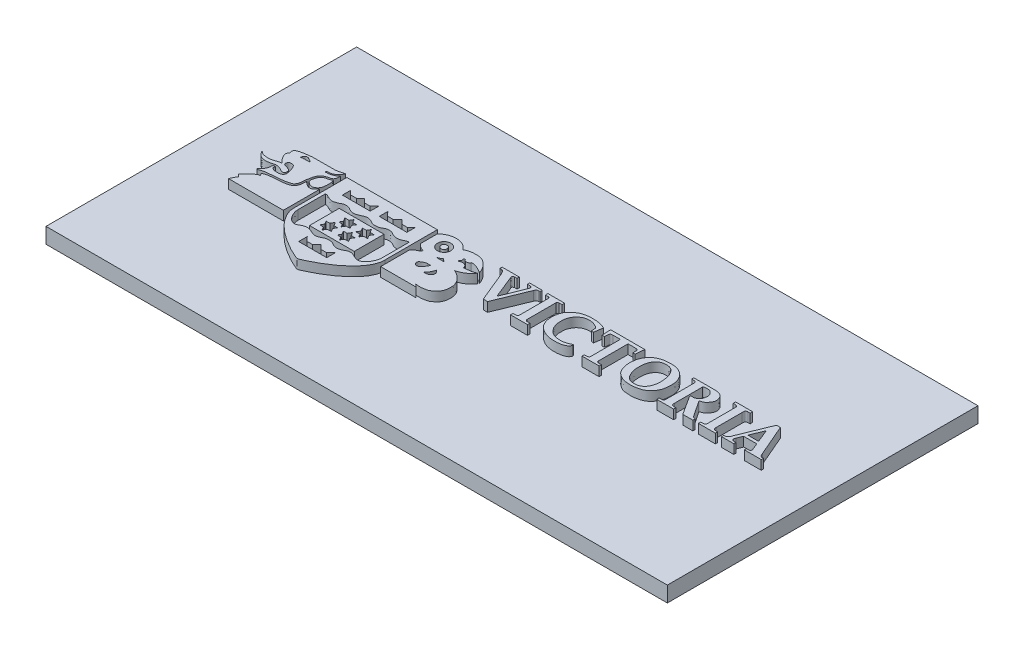
from build123d import *

# Parameters (mm, degrees)
SKETCH1_W           = 200
SKETCH1_H           = 100
BOSS_EXTRUDE1_DEPTH = 5
SKETCH5_R           = 2.143894701
BOSS_EXTRUDE3_DEPTH = 3
SKETCH5_3_W         = 14.41132594
SKETCH5_3_H         = 9.558249628
SKETCH5_3_R         = 0.989458564
BOSS_EXTRUDE4_DEPTH = 3


with BuildPart() as part:
    # Sketch1 → Boss-Extrude1 (new body)
    with BuildSketch(Plane(origin=(0, 0, 0), x_dir=(1, 0, 0), z_dir=(0, 1, 0))):
        Rectangle(SKETCH1_W, SKETCH1_H)
    extrude(amount=BOSS_EXTRUDE1_DEPTH)

    # Sketch5 → Boss-Extrude3 (add)
    # profile 1 of 13: a face of its own
    with BuildSketch(Plane(origin=(0, 5, 0), x_dir=(1, 0, 0), z_dir=(0, 1, 0))):
        with BuildLine():
            Line((-63.283166059, -10.311134078), (-63.283166059, 1.373853789))
            add(Edge.make_bspline(
                [(-80.903714055, -10.311134078), (-80.856683264, -9.888312313), (-80.400800592, -9.362663986), (-80.157531155, -8.594305814), (-79.911209896, -8.308751368), (-79.781007463, -8.153542612), (-79.991127499, -7.996810384), (-80.162171046, -7.827277063), (-80.381110118, -7.681743058), (-80.615269402, -7.456702061), (-80.389779728, -7.310528979), (-80.300552877, -7.103815631), (-80.060636971, -6.947854996), (-79.939504866, -6.658845543), (-79.683496145, -6.433065), (-79.416142552, -6.225120293), (-79.178429481, -5.909778113), (-78.832255732, -5.621183705), (-78.47889549, -5.353746245), (-78.186251702, -5.05760081), (-77.902886181, -4.847865328), (-77.612103844, -4.650200381), (-77.309035222, -4.456523123), (-76.958395472, -4.357557253), (-76.736483954, -4.390747801), (-76.499412598, -4.313856384), (-76.674403661, -4.222818699), (-76.782548313, -4.111338792), (-76.951429305, -3.961113457), (-76.981132542, -3.781476055), (-77.108662934, -3.691593107), (-76.984219704, -3.553477829), (-76.821266945, -3.491015762), (-76.642042219, -3.30190718), (-76.356111996, -3.244439062), (-76.045646115, -3.140442093), (-75.64088629, -3.038052469), (-75.139928715, -2.951242258), (-74.559702195, -2.941266374), (-74.050596444, -2.82899301), (-73.587687513, -2.869364074), (-73.13080307, -2.752608204), (-72.529458147, -2.709939541), (-71.865979355, -2.680506971), (-71.228161254, -2.657259405), (-70.650578937, -2.528955422), (-70.066398669, -2.476029844), (-69.415694963, -2.262756639), (-68.761320966, -2.034587365), (-68.164848126, -1.539122688), (-67.877312077, -0.900727809), (-67.678504157, -0.26285911), (-67.604908909, 0.426021816), (-67.59898699, 1.026916374), (-67.573360912, 1.366004939), (-67.584588655, 1.535686091), (-67.444849643, 1.431897383), (-67.423380431, 1.299934716), (-67.274655994, 1.123199209), (-67.067888604, 1.025955291), (-66.901332432, 0.81573915), (-66.666069177, 0.665306076), (-66.381973993, 0.484522977), (-66.095757591, 0.313506358), (-65.771166739, 0.214663654), (-65.450377689, 0.129322739), (-65.077171478, 0.091354901), (-64.704079619, 0.205663372), (-64.36312652, 0.453633415), (-64.02783364, 0.744247371), (-63.690638785, 1.000023947), (-63.474818288, 1.244284099), (-63.384721339, 1.424324463), (-63.283166059, 1.373853789)],
                knots=[0, 0, 0, 0, 0.044727949, 0.076095667, 0.084620858, 0.088722162, 0.095224687, 0.107117358, 0.117598152, 0.12632139, 0.13419106, 0.140594358, 0.151685856, 0.163923512, 0.174209887, 0.188942408, 0.201320064, 0.217531518, 0.238556002, 0.250302024, 0.263444351, 0.277471635, 0.289076417, 0.303608236, 0.314612495, 0.318388932, 0.32285075, 0.328773874, 0.338724192, 0.345324539, 0.348717892, 0.352734553, 0.361178541, 0.369737086, 0.37990455, 0.392591261, 0.406163188, 0.42596187, 0.448676137, 0.470163609, 0.483089202, 0.499515099, 0.521778291, 0.549654919, 0.573043646, 0.59210845, 0.614943667, 0.637595681, 0.667614925, 0.691050126, 0.720933441, 0.743473942, 0.76460259, 0.798327908, 0.80506505, 0.808129672, 0.811612582, 0.817581269, 0.824422472, 0.835458236, 0.842573333, 0.853558934, 0.866045916, 0.879965481, 0.890146869, 0.903404045, 0.916740876, 0.931013295, 0.945346224, 0.963028113, 0.980302157, 0.991498863, 1, 1, 1, 1], degree=3))
            Line((-80.903714055, -10.311134078), (-63.283166059, -10.311134078))
        make_face()
    # profile 2 of 13: a face of its own
    with BuildSketch(Plane(origin=(0, 5, 0), x_dir=(1, 0, 0), z_dir=(0, 1, 0))):
        with BuildLine():
            Line((-33.087033974, 9.049574075), (-62.209328463, 9.049574075))
            Line((-62.209328463, 9.049574075), (-62.209328463, -7.826517048))
            add(Edge.make_bspline(
                [(-62.209328463, -7.826517048), (-62.223611334, -8.420607225), (-62.147702892, -9.357654807), (-61.704570785, -10.405774753), (-61.415861108, -11.072053428), (-61.085423492, -11.590336841), (-60.819873467, -12.16205615), (-60.369451276, -12.646598187), (-60.059213276, -13.162226499), (-59.653780288, -13.576285059), (-59.357478437, -14.052514208), (-58.890344102, -14.400144848), (-58.552317735, -14.808070578), (-58.135168968, -15.138232389), (-57.737363922, -15.53219111), (-57.312920719, -15.957750788), (-56.741185316, -16.386329531), (-56.111017414, -16.837334967), (-55.415465073, -17.36589135), (-54.703069589, -17.893601429), (-53.874265971, -18.356009853), (-52.994400953, -18.947160994), (-52.013764501, -19.505219417), (-50.918542775, -20.132624571), (-49.715351254, -20.714530074), (-48.617982696, -21.156726636), (-47.917471144, -21.502785007), (-47.251925435, -21.501424295), (-46.616684887, -21.180278547), (-45.74364458, -20.756541906), (-44.886481163, -20.394436649), (-43.839085801, -19.785099657), (-42.728976128, -19.282062332), (-41.822137384, -18.618968022), (-41.062197101, -18.185738276), (-40.255588753, -17.590428361), (-39.158503272, -17.00054878), (-38.362952334, -16.144262319), (-37.565005123, -15.589463365), (-36.988954762, -15.096958849), (-36.488718026, -14.448546693), (-35.819582772, -13.948413874), (-35.331227737, -13.251876172), (-34.84129076, -12.640616607), (-34.381252363, -12.028200551), (-34.039916143, -11.393193763), (-33.728975923, -10.760473844), (-33.478324525, -10.211752183), (-33.168539038, -9.2539561), (-33.040809768, -8.464527884), (-33.087033974, -7.826517048)],
                knots=[0, 0, 0, 0, 0.042744702, 0.065587763, 0.081029106, 0.094527413, 0.109445821, 0.125721284, 0.141362611, 0.15220027, 0.166973682, 0.180921032, 0.193282425, 0.20465161, 0.218792191, 0.233277462, 0.24751857, 0.269744212, 0.288662347, 0.309936615, 0.332989395, 0.356357403, 0.385629891, 0.41353483, 0.446608274, 0.480612804, 0.499340582, 0.500190577, 0.528083172, 0.547671863, 0.570277339, 0.594253874, 0.634235093, 0.656911408, 0.674293258, 0.696649025, 0.72848131, 0.762545413, 0.779125162, 0.79787212, 0.816417692, 0.837311173, 0.856850995, 0.876739058, 0.893394512, 0.911440478, 0.928113728, 0.943801852, 0.954450612, 1, 1, 1, 1], degree=3))
            Line((-33.087033974, -7.826517048), (-33.087033974, 9.049574075))
        make_face()
        Polygon((-43.087643254, -16.551320804), (-52.110677227, -16.551320804), (-52.110677227, -13.789555653), (-50.866334758, -15.170438228), (-49.063325432, -15.170438228), (-47.666785498, -13.773898295), (-46.270245565, -15.170438228), (-44.484183187, -15.170438228), (-43.087643254, -13.773898295), align=None, mode=Mode.SUBTRACT)
        with BuildLine():
            add(Edge.make_bspline(
                [(-61.106333757, 1.044862887), (-60.550114803, 1.078370375), (-59.831943985, 0.657276143), (-58.802921124, 0.172672351), (-57.771769356, 0.030089416), (-56.899428442, 0.381957032), (-56.124151668, 0.65286917), (-55.494838076, 1.087230789), (-54.707979785, 1.191934216), (-53.933268916, 1.126289317), (-53.313391386, 0.931985165), (-52.859774368, 0.615685085), (-52.374208122, 0.415450837), (-51.92938191, 0.144943812), (-51.305151939, 0.098947453), (-50.616882182, 0.163801812), (-49.885541378, 0.405950628), (-49.229337694, 0.726485749), (-48.620433802, 1.015772418), (-47.990340764, 1.190798724), (-47.250997519, 1.199258043), (-46.526873253, 0.928397166), (-45.832792242, 0.684471494), (-45.262010528, 0.217132962), (-44.575100549, 0.162326561), (-43.841644644, 0.159026384), (-43.079340992, 0.277747754), (-42.356133913, 0.63587579), (-41.745636499, 1.080086914), (-41.039654092, 1.179660633), (-40.30346453, 1.199620391), (-39.431854458, 0.943291452), (-38.654684943, 0.416272838), (-37.88297859, 0.236151865), (-37.066947745, 0.135603224), (-36.21984093, 0.29101926), (-35.213099399, 0.757296929), (-34.574589443, 1.101740059), (-34.133410576, 1.061452069)],
                knots=[0, 0, 0, 0, 0.055543947, 0.08629356, 0.12004875, 0.161437862, 0.18333029, 0.206677282, 0.240875107, 0.264007063, 0.288750082, 0.308187582, 0.32186975, 0.344145665, 0.361977019, 0.38658574, 0.416898736, 0.442463684, 0.46365945, 0.487890017, 0.510902227, 0.54021374, 0.568663547, 0.588121718, 0.616068455, 0.638164593, 0.66621975, 0.6961474, 0.722721347, 0.744306345, 0.769848027, 0.800195999, 0.838188386, 0.867733621, 0.882609215, 0.924852637, 0.955794948, 1, 1, 1, 1], degree=3))
            Line((-34.133410576, 1.061452069), (-34.133410576, -7.826517048))
            add(Edge.make_bspline(
                [(-61.106333757, -7.826517048), (-61.128880642, -8.567381891), (-60.766667061, -9.428643338), (-60.285029507, -10.522107363), (-59.789020035, -11.1229071), (-59.235378104, -11.815471707), (-58.476151657, -12.145668376), (-57.668323915, -12.355394699), (-56.87340605, -12.057563858), (-56.152150093, -11.575839587), (-55.349039959, -11.300422077), (-54.465023067, -11.184385291), (-53.648999738, -11.366422187), (-52.949624995, -11.670880126), (-52.359595864, -11.98233987), (-51.733942174, -12.23959105), (-50.679556193, -12.321974753), (-49.667289322, -11.887763123), (-48.618900625, -11.297379309), (-47.826834473, -11.239030924), (-47.023885329, -11.26516572), (-46.35302653, -11.459358634), (-45.740977779, -11.835515971), (-45.120032138, -12.115641438), (-44.396941682, -12.338778017), (-43.553170936, -12.265437597), (-42.822814465, -11.968797427), (-42.107632059, -11.556760141), (-41.415663469, -11.247648979), (-40.620717035, -11.157415441), (-39.886529363, -11.370358923), (-39.063464156, -11.676976763), (-38.264609212, -12.203760273), (-37.326820282, -12.272140838), (-36.277862108, -12.023180549), (-35.44563443, -11.197922317), (-34.566997687, -9.789425813), (-34.146241616, -8.644514382), (-34.133410576, -7.826517048)],
                knots=[0, 0, 0, 0, 0.062933835, 0.084534597, 0.106498042, 0.132747492, 0.162843066, 0.178970509, 0.206403155, 0.234812252, 0.257469012, 0.281815998, 0.314049535, 0.330893164, 0.350297743, 0.374037615, 0.390983023, 0.443874361, 0.469082849, 0.498456421, 0.513280978, 0.5413852, 0.559680164, 0.577664638, 0.60255265, 0.626637054, 0.651997063, 0.672744898, 0.700874852, 0.719370493, 0.743227648, 0.768474036, 0.798423678, 0.82743031, 0.849988951, 0.893562834, 0.927221799, 1, 1, 1, 1], degree=3))
            Line((-61.106333757, -7.826517048), (-61.106333757, 1.044862887))
        make_face(mode=Mode.SUBTRACT)
        Polygon((-49.063325432, 3.415154074), (-58.007374204, 3.415154074), (-58.007374204, 6.070630459), (-56.725249742, 4.788505997), (-54.877319073, 4.788505997), (-53.535349818, 6.130475252), (-52.193380563, 4.788505997), (-50.436677355, 4.788505997), (-49.063325432, 6.16185792), align=None, mode=Mode.SUBTRACT)
        Polygon((-46.139661916, 3.415154074), (-46.139661916, 6.16185792), (-44.872424653, 4.803283502), (-43.110285584, 4.803283502), (-41.700058458, 6.213510629), (-40.351682779, 4.865134951), (-38.557177968, 4.865134951), (-37.260454999, 6.16185792), (-37.260454999, 3.415154074), align=None, mode=Mode.SUBTRACT)
    # profile 3 of 13: a face of its own
    with BuildSketch(Plane(origin=(0, 5, 0), x_dir=(1, 0, 0), z_dir=(0, 1, 0))):
        with BuildLine():
            add(Edge.make_bspline(
                [(-23.342264199, 7.545540249), (-23.672904406, 8.029140409), (-24.426583649, 8.765212124), (-25.82525957, 9.512750578), (-27.368277457, 9.704820245), (-29.036985546, 9.608992993), (-30.65693015, 8.955695587), (-31.540076328, 8.201227044), (-31.921838602, 7.783283119)],
                knots=[0, 0, 0, 0, 0.178613289, 0.318982495, 0.477007698, 0.647910067, 0.826705352, 1, 1, 1, 1], degree=3))
            Line((-31.921838602, 7.783283119), (-31.921838602, 2.565075319))
            add(Edge.make_bspline(
                [(-31.921838602, -0.959278605), (-31.682686752, -0.730105535), (-31.246034301, -0.373253192), (-30.578984422, 0.012476599), (-30.026131501, 0.220230754), (-29.753169678, 0.549589112), (-29.524402395, 0.860497489), (-29.816012777, 1.102588389), (-30.1715122, 1.125337255), (-30.685526301, 1.330888796), (-31.287440333, 1.825447706), (-31.798268081, 2.195675357), (-31.921838602, 2.565075319)],
                knots=[0, 0, 0, 0, 0.167260575, 0.280115119, 0.391310729, 0.448966334, 0.506302735, 0.545037078, 0.608247957, 0.687788788, 0.816650379, 1, 1, 1, 1], degree=3))
            Line((-31.921838602, -0.959278605), (-31.921838602, -10.3593181))
            Line((-31.921838602, -10.3593181), (-20.548463142, -10.3593181))
            add(Edge.make_bspline(
                [(-20.548463142, -10.3593181), (-20.690169311, -10.152966306), (-21.028207107, -9.791285476), (-21.32508953, -9.691211598), (-21.498625745, -9.549608527), (-21.38531335, -9.567401191), (-21.185580228, -9.544678873), (-20.804506243, -9.684878225), (-20.281157243, -9.679386716), (-19.76177878, -9.685274922), (-19.239376685, -9.632436029), (-18.708740178, -9.556071309), (-18.117156264, -9.435559564), (-17.378064742, -9.229982315), (-16.623009533, -8.664319785), (-15.844112266, -8.117715099), (-15.391308796, -7.364796024), (-15.081158616, -6.670468088), (-14.877242965, -5.862536972), (-14.871815746, -4.941418225), (-14.815209729, -4.063004422), (-15.054822907, -3.339427983), (-15.346378286, -2.590110697), (-15.885083272, -1.794659156), (-16.63196195, -0.942367535), (-17.416332076, -0.356107975), (-18.19591782, 0.115614408), (-18.700963651, 0.335224459), (-19.015362167, 0.40295312)],
                knots=[0, 0, 0, 0, 0.047311833, 0.065555571, 0.068886764, 0.072240714, 0.077912826, 0.108647754, 0.132673809, 0.167071751, 0.195287611, 0.220799851, 0.256954468, 0.296851956, 0.347894575, 0.41397467, 0.454077007, 0.493307928, 0.541711161, 0.592299153, 0.64796658, 0.687349555, 0.718815557, 0.782883517, 0.84704878, 0.908354783, 0.946211382, 1, 1, 1, 1], degree=3))
            add(Edge.make_bspline(
                [(-19.015362167, 0.40295312), (-17.195285517, 0.787051534), (-15.527555678, 1.890610408), (-14.478556775, 3.445259634)],
                knots=[0, 0, 0, 0, 1, 1, 1, 1], degree=3))
            add(Edge.make_bspline(
                [(-14.478556775, 3.445259634), (-14.998116976, 3.167579259), (-15.840094343, 2.886579147), (-17.167636476, 2.768563028), (-17.901206361, 2.617440427), (-18.36194365, 2.635435319)],
                knots=[0, 0, 0, 0, 0.442148354, 0.655070643, 1, 1, 1, 1], degree=3))
            add(Edge.make_bspline(
                [(-18.36194365, 2.635435319), (-18.27735476, 3.049035953), (-18.685947619, 3.656769386), (-19.564926451, 3.988460507), (-20.329842635, 4.018620937), (-20.689752116, 3.588803508), (-21.065116934, 3.714319633), (-20.902149866, 4.097696023), (-20.582349324, 4.340011927), (-20.624495469, 4.771226144), (-20.77372742, 5.125939518), (-20.483635574, 5.311257952), (-20.177652029, 5.247675859), (-20.114233643, 4.910809796), (-19.643416437, 4.744082371), (-19.112764798, 4.759790841), (-18.633260539, 4.93054883), (-18.300383688, 5.154986886), (-18.405718937, 5.434985072), (-18.183299862, 5.414661204), (-17.859545641, 5.358060433), (-17.197738832, 5.255254157), (-15.94451159, 4.827515185), (-14.95570904, 4.295463236), (-14.323743695, 3.803340989)],
                knots=[0, 0, 0, 0, 0.09570499, 0.157406657, 0.231164579, 0.262504401, 0.28131965, 0.304328191, 0.341480827, 0.37941162, 0.40092338, 0.425807103, 0.445368092, 0.468277521, 0.498049346, 0.556338794, 0.596569859, 0.627463779, 0.639447878, 0.645271086, 0.672698219, 0.729115932, 0.803292351, 1, 1, 1, 1], degree=3))
            add(Edge.make_bspline(
                [(-14.323743695, 3.803340989), (-14.484322888, 4.395296449), (-14.875207142, 5.269842309), (-15.62101847, 6.312829703), (-16.362593288, 7.082558736), (-17.266603081, 7.793563213), (-18.494470191, 8.352270399), (-19.89259095, 8.402423755), (-21.22786245, 8.355338875), (-22.371468289, 8.025363529), (-23.07131154, 7.806995771), (-23.342264199, 7.545540249)],
                knots=[0, 0, 0, 0, 0.161629313, 0.250595519, 0.337392553, 0.443077719, 0.553128084, 0.68665681, 0.807763151, 0.904497994, 1, 1, 1, 1], degree=3))
        make_face()
        with BuildLine():
            add(Edge.make_bspline(
                [(-21.986118744, -2.324138385), (-21.658179071, -2.621714338), (-20.921458184, -3.305850896), (-21.568193433, -4.870598703), (-22.775407012, -5.096241044), (-23.487146283, -4.969848311)],
                knots=[0, 0, 0, 0, 0.334220384, 0.506123893, 1, 1, 1, 1], degree=3))
            add(Edge.make_bspline(
                [(-23.487146283, -4.969848311), (-22.722905076, -4.287484969), (-22.115212205, -3.356951376), (-21.986118744, -2.324138385)],
                knots=[0, 0, 0, 0, 1, 1, 1, 1], degree=3))
        make_face(mode=Mode.SUBTRACT)
        with BuildLine():
            add(Edge.make_bspline(
                [(-24.156372472, -1.965162674), (-24.42716302, -2.466481474), (-24.827628878, -3.205782787), (-25.482273047, -4.071006882), (-26.252914365, -4.420263195), (-27.051100175, -4.164127292), (-27.888455779, -2.747961869), (-25.645942274, -1.960860378), (-25.277864395, -1.965162674)],
                knots=[0, 0, 0, 0, 0.228004413, 0.340633351, 0.42813331, 0.550140895, 0.644082761, 1, 1, 1, 1], degree=3))
            Line((-25.277864395, -1.965162674), (-24.156372472, -1.965162674))
        make_face(mode=Mode.SUBTRACT)
        with BuildLine():
            Line((-22.970538661, 1.163504897), (-25.50832241, 1.163504897))
            add(Edge.make_bspline(
                [(-25.50832241, 1.163504897), (-25.047567966, 1.413475651), (-24.310882776, 1.545813707), (-24.056353129, 2.086767421)],
                knots=[0, 0, 0, 0, 1, 1, 1, 1], degree=3))
            add(Edge.make_bspline(
                [(-22.970538661, 1.163504897), (-23.338369515, 1.447301122), (-23.854954628, 1.627002668), (-24.056353129, 2.086767421)],
                knots=[0, 0, 0, 0, 1, 1, 1, 1], degree=3))
        make_face(mode=Mode.SUBTRACT)
        with Locations((-27.170207698, 5.324777386)):
            Circle(SKETCH5_R, mode=Mode.SUBTRACT)
    # profile 4 of 13: a face of its own
    with BuildSketch(Plane(origin=(0, 5, 0), x_dir=(1, 0, 0), z_dir=(0, 1, 0))):
        with BuildLine():
            Line((-6.690237885, 9.049574075), (-12.22534272, 9.049574075))
            Line((-12.22534272, 9.049574075), (-12.22534272, 8.337457413))
            Line((-12.22534272, 8.337457413), (-11.690833019, 8.337457413))
            add(Edge.make_bspline(
                [(-10.450715145, 7.015844375), (-10.749533067, 7.471265436), (-11.017038592, 8.296579831), (-11.690833019, 8.337457413)],
                knots=[0, 0, 0, 0, 1, 1, 1, 1], degree=3))
            Line((-10.450715145, 7.015844375), (-6.327751146, -2.896014384))
            Line((-6.327751146, -2.896014384), (-4.961901365, -2.896014384))
            Line((-4.961901365, -2.896014384), (-0.678836073, 7.545540249))
            add(Edge.make_bspline(
                [(-0.678836073, 7.545540249), (-0.557814387, 7.929914412), (-0.252977784, 8.313084233), (0.185479461, 8.337457413)],
                knots=[0, 0, 0, 0, 1, 1, 1, 1], degree=3))
            Line((0.185479461, 8.337457413), (0.683160918, 8.337457413))
            Line((0.683160918, 8.337457413), (0.683160918, 9.049574075))
            Line((0.683160918, 9.049574075), (-3.377173182, 9.049574075))
            Line((-3.377173182, 9.049574075), (-3.377173182, 8.337457413))
            Line((-3.377173182, 8.337457413), (-2.359161235, 8.337457413))
            add(Edge.make_bspline(
                [(-2.01395888, 7.316462604), (-1.813720425, 7.655131589), (-1.887609606, 8.260381535), (-2.359161235, 8.337457413)],
                knots=[0, 0, 0, 0, 1, 1, 1, 1], degree=3))
            Line((-2.01395888, 7.316462604), (-4.933051072, 0.055721809))
            Line((-4.933051072, 0.055721809), (-7.859762219, 7.316462604))
            add(Edge.make_bspline(
                [(-7.859762219, 7.316462604), (-7.933460071, 7.460758201), (-8.2020296, 7.896370609), (-7.834658796, 8.237209679), (-7.6237242, 8.294826041), (-7.471623745, 8.337457413)],
                knots=[0, 0, 0, 0, 0.528888711, 0.668401412, 1, 1, 1, 1], degree=3))
            Line((-7.471623745, 8.337457413), (-6.690237885, 8.337457413))
            Line((-6.690237885, 8.337457413), (-6.690237885, 9.049574075))
        make_face()
    # profile 5 of 13: a face of its own
    with BuildSketch(Plane(origin=(0, 5, 0), x_dir=(1, 0, 0), z_dir=(0, 1, 0))):
        with BuildLine():
            add(Edge.make_bspline(
                [(7.152384129, -2.110782839), (6.465070909, -2.152288167), (6.372055021, -1.521517899)],
                knots=[0.876522879, 0.876522879, 0.876522879, 1.876522879, 1.876522879, 1.876522879], degree=2))
            Line((6.372055021, -1.521517899), (6.372055021, 7.783283119))
            add(Edge.make_bspline(
                [(6.372055021, 7.783283119), (6.49779507, 8.137282038), (6.877883784, 8.242013012)],
                knots=[0, 0, 0, 1, 1, 1], degree=2))
            Line((6.877883784, 8.242013012), (7.904025526, 8.242013012))
            Line((7.904025526, 8.242013012), (7.904025526, 9.049574075))
            Line((7.904025526, 9.049574075), (2.507906772, 9.049574075))
            Line((2.507906772, 9.049574075), (2.507906772, 8.242013012))
            Line((2.507906772, 8.242013012), (3.530036988, 8.242013012))
            add(Edge.make_bspline(
                [(3.949941955, 7.783283119), (3.903213938, 8.140390171), (3.530036988, 8.242013012)],
                knots=[0, 0, 0, 1, 1, 1], degree=2))
            Line((3.949941955, 7.783283119), (3.949941955, -1.521517899))
            add(Edge.make_bspline(
                [(3.949941955, -1.521517899), (3.909344428, -2.03297914), (3.360657771, -2.110782839)],
                knots=[0, 0, 0, 1, 1, 1], degree=2))
            Line((3.360657771, -2.110782839), (2.427955678, -2.110782839))
            Line((2.427955678, -2.110782839), (2.427955678, -2.896014384))
            Line((2.427955678, -2.896014384), (7.904025526, -2.896014384))
            Line((7.904025526, -2.896014384), (7.904025526, -2.110782839))
            Line((7.904025526, -2.110782839), (7.152384129, -2.110782839))
        make_face()
    # profile 6 of 13: a face of its own
    with BuildSketch(Plane(origin=(0, 5, 0), x_dir=(1, 0, 0), z_dir=(0, 1, 0))):
        with BuildLine():
            Line((20.60352374, 5.573225791), (21.047160804, 8.385119305))
            add(Edge.make_bspline(
                [(20.991592089, -1.388898964), (20.842009108, -1.654487027), (20.648654965, -2.240788359), (19.876335987, -2.560354356), (19.129550456, -2.920762803), (18.106949306, -3.073542108), (16.833724664, -3.183477294), (15.451725974, -3.094631951), (14.101721943, -2.83764633), (12.956287931, -2.353987985), (11.877938449, -1.675708093), (10.873567075, -0.881833019), (10.212590055, 0.262719962), (9.701350117, 1.726013512), (9.593777136, 3.367624231), (9.811850869, 4.87363125), (10.259281649, 6.301323704), (11.297827413, 7.412478159), (12.431341817, 8.292554346), (13.411696862, 8.849880942), (14.415292837, 9.036574453), (15.524099134, 9.290089688), (16.777800831, 9.286104851), (18.042372185, 9.286952937), (19.500365267, 9.001716121), (20.468834012, 8.707021794), (21.047160804, 8.385119305)],
                knots=[0, 0, 0, 0, 0.031887303, 0.053208623, 0.078851241, 0.113610909, 0.15315044, 0.204340227, 0.248697567, 0.287259544, 0.325282262, 0.373718346, 0.410567601, 0.453084321, 0.524991553, 0.568836794, 0.602077009, 0.669992308, 0.712556371, 0.743480007, 0.77913171, 0.811791681, 0.854793744, 0.901392444, 0.935448367, 1, 1, 1, 1], degree=3))
            add(Edge.make_bspline(
                [(19.842555034, 7.015844375), (19.59120159, 7.406115292), (19.00377415, 7.688002711), (18.148535644, 8.072008861), (17.417977257, 8.26105902), (16.542174192, 8.312062052), (15.670324261, 8.222142844), (14.885131145, 8.018262198), (14.255379901, 7.617781564), (13.555173906, 7.130974644), (12.816745603, 6.047754477), (12.271437274, 4.775556929), (12.321591989, 3.409080927), (12.280124293, 2.320532285), (12.624462678, 1.357873401), (12.91005948, 0.475356161), (13.564353949, -0.362633874), (14.317515741, -1.20105755), (15.467687722, -1.71192238), (16.699799559, -2.030544669), (18.266947237, -2.017257496), (19.584383747, -1.685932807), (20.383426278, -1.292019562), (20.65736691, -1.121072212), (20.767736283, -1.07340467), (20.950256743, -1.156331935), (20.947771887, -1.317207105), (20.991592089, -1.388898964)],
                knots=[0, 0, 0, 0, 0.056870518, 0.082977528, 0.121505448, 0.153620825, 0.195996434, 0.234794598, 0.256885002, 0.292270865, 0.344149006, 0.424447353, 0.465428574, 0.520130999, 0.563675956, 0.596576887, 0.639361253, 0.699951819, 0.739739609, 0.800095265, 0.863637708, 0.940376653, 0.973878556, 0.97810557, 0.982408639, 0.98888216, 1, 1, 1, 1], degree=3))
            Line((19.842555034, 7.015844375), (19.925018112, 5.68027474))
            Line((19.925018112, 5.68027474), (20.60352374, 5.573225791))
        make_face()
    # profile 7 of 13: a face of its own
    with BuildSketch(Plane(origin=(0, 5, 0), x_dir=(1, 0, 0), z_dir=(0, 1, 0))):
        with BuildLine():
            Line((24.524361102, 7.931246689), (26.938164585, 7.931246689))
            Line((26.938164585, 7.931246689), (26.938164585, -1.521517899))
            add(Edge.make_bspline(
                [(26.938164585, -1.521517899), (27.045116593, -2.106539378), (26.21255349, -2.186982877), (25.850288311, -2.182606174)],
                knots=[0, 0, 0, 0, 1, 1, 1, 1], degree=3))
            Line((25.850288311, -2.182606174), (25.418672364, -2.182606174))
            Line((25.418672364, -2.182606174), (25.418672364, -2.896014384))
            Line((25.418672364, -2.896014384), (30.929279929, -2.896014384))
            Line((30.929279929, -2.896014384), (30.929279929, -2.182606174))
            Line((30.929279929, -2.182606174), (29.98489698, -2.182606174))
            add(Edge.make_bspline(
                [(29.421702486, -1.521517899), (29.367285334, -1.855317002), (29.666258261, -2.151634774), (29.98489698, -2.182606174)],
                knots=[0, 0, 0, 0, 1, 1, 1, 1], degree=3))
            Line((29.421702486, -1.521517899), (29.421702486, 7.931246689))
            Line((29.421702486, 7.931246689), (31.932769845, 7.931246689))
            add(Edge.make_bspline(
                [(31.932769845, 7.931246689), (32.09793136, 7.903447888), (32.485133348, 7.908413053), (32.708065135, 7.439859143), (32.689918721, 6.882942428), (32.687576867, 6.433867281), (32.740512706, 6.16185792)],
                knots=[0, 0, 0, 0, 0.260710933, 0.402942805, 0.634783919, 1, 1, 1, 1], degree=3))
            Line((32.740512706, 6.16185792), (33.462156031, 6.16185792))
            Line((33.462156031, 6.16185792), (33.704861889, 9.049574075))
            Line((33.704861889, 9.049574075), (22.680408165, 9.049574075))
            Line((22.680408165, 9.049574075), (22.867278358, 6.16185792))
            Line((22.867278358, 6.16185792), (23.61608827, 6.16185792))
            add(Edge.make_bspline(
                [(24.524361102, 7.931246689), (24.366790133, 7.895028199), (23.779138243, 7.954708707), (23.648670576, 7.056722493), (23.620182483, 6.618169932), (23.61608827, 6.16185792)],
                knots=[0, 0, 0, 0, 0.298093113, 0.492105915, 1, 1, 1, 1], degree=3))
        make_face()
    # profile 8 of 13: a face of its own
    with BuildSketch(Plane(origin=(0, 5, 0), x_dir=(1, 0, 0), z_dir=(0, 1, 0))):
        with BuildLine():
            Line((56.42250011, 9.049574075), (49.491846863, 9.049574075))
            Line((49.491846863, 9.049574075), (49.491846863, 8.385119305))
            add(Edge.make_bspline(
                [(49.491846863, 8.385119305), (49.856681514, 8.327707135), (50.509443604, 8.447240289), (51.083119358, 7.816051209), (50.975997782, 7.389861871), (51.000762682, 7.175508604)],
                knots=[0, 0, 0, 0, 0.522294447, 0.698694149, 1, 1, 1, 1], degree=3))
            Line((51.000762682, 7.175508604), (51.000762682, -1.224938948))
            add(Edge.make_bspline(
                [(51.000762682, -1.224938948), (50.954746625, -1.431510371), (51.026727217, -2.185360676), (50.219954026, -2.124917949), (50.019462699, -2.182606174)],
                knots=[0, 0, 0, 0, 0.476664074, 1, 1, 1, 1], degree=3))
            Line((50.019462699, -2.182606174), (49.533727769, -2.182606174))
            Line((49.533727769, -2.182606174), (49.533727769, -2.919954677))
            Line((49.533727769, -2.919954677), (54.932600012, -2.919954677))
            Line((54.932600012, -2.919954677), (54.932600012, -2.182606174))
            Line((54.932600012, -2.182606174), (54.391299389, -2.182606174))
            add(Edge.make_bspline(
                [(54.391299389, -2.182606174), (54.182925796, -2.198328195), (53.516473051, -2.132030925), (53.433399164, -1.421453458), (53.450360634, -1.15150393)],
                knots=[0.869554856, 0.869554856, 0.869554856, 0.869554856, 1.298549149, 1.869554856, 1.869554856, 1.869554856, 1.869554856], degree=3))
            Line((53.450360634, -1.15150393), (53.450360634, 7.877891505))
            add(Edge.make_bspline(
                [(53.450360634, 7.877891505), (53.487661186, 8.039178625), (53.825096119, 8.159880882), (54.434825331, 8.220029285), (55.061567571, 8.133269116), (55.724633075, 8.085272734), (55.993751717, 7.713141786), (56.260374632, 7.518926239), (56.438735972, 7.348268361), (56.594217094, 7.107211201), (56.798006766, 6.787479194), (56.786542135, 6.371892004), (56.951504523, 5.970500572), (56.785247979, 5.557525282), (56.807305659, 5.081998189), (56.551409175, 4.64981496), (56.28160104, 4.149780975), (55.732150759, 3.792618846), (55.228192349, 3.491141226), (54.789130277, 3.521939008), (54.504850038, 3.496530938), (54.230995787, 3.561532978), (54.076005986, 3.454719089), (53.988341617, 3.36553008), (54.025147387, 3.128172937), (54.043949056, 2.948148742), (54.181134857, 2.840506447)],
                knots=[0, 0, 0, 0, 0.044173095, 0.100927665, 0.188336448, 0.239626012, 0.292506335, 0.318919259, 0.340937147, 0.36715012, 0.406687028, 0.453319714, 0.49055723, 0.53347722, 0.582231425, 0.632406742, 0.682921763, 0.753662731, 0.829504297, 0.853365834, 0.885842804, 0.918268148, 0.931523161, 0.942165266, 0.953814356, 1, 1, 1, 1], degree=3))
            Line((54.181134857, 2.840506447), (57.895351292, -2.919954677))
            Line((57.895351292, -2.919954677), (61.14283012, -2.919954677))
            Line((61.14283012, -2.919954677), (61.14283012, -2.182606174))
            add(Edge.make_bspline(
                [(61.14283012, -2.182606174), (60.712815539, -2.197754424), (60.322963598, -1.92879651), (60.089050097, -1.587050293)],
                knots=[0, 0, 0, 0, 1, 1, 1, 1], degree=3))
            Line((60.089050097, -1.587050293), (57.040854247, 2.995564437))
            add(Edge.make_bspline(
                [(56.42250011, 9.049574075), (56.904691574, 8.998538938), (57.667335234, 8.9691884), (58.411456996, 8.486817274), (58.898699515, 8.094904653), (59.217566691, 7.49683479), (59.495224633, 6.677814232), (59.434346667, 5.671682767), (58.903729363, 4.868920518), (58.330946391, 4.100673291), (57.604267386, 3.665715603), (57.059273587, 3.567848468), (56.663573514, 3.401743609), (57.010456616, 3.015398306), (57.040854247, 2.995564437)],
                knots=[0, 0, 0, 0, 0.162550787, 0.232353299, 0.285065551, 0.36375905, 0.447390184, 0.565319245, 0.674093267, 0.7539995, 0.87766438, 0.92945627, 0.944095546, 1, 1, 1, 1], degree=3))
        make_face()
    # profile 9 of 13: a face of its own
    with BuildSketch(Plane(origin=(0, 5, 0), x_dir=(1, 0, 0), z_dir=(0, 1, 0))):
        with BuildLine():
            add(Edge.make_bspline(
                [(66.917481871, 7.142776484), (66.923452969, 7.374016977), (66.806844195, 8.056935707), (67.428511434, 8.255250749), (67.647539625, 8.265295075)],
                knots=[0, 0, 0, 0, 0.542404253, 1, 1, 1, 1], degree=3))
            Line((67.647539625, 8.265295075), (68.388585806, 8.265295075))
            Line((68.388585806, 8.265295075), (68.388585806, 9.049574075))
            Line((68.388585806, 9.049574075), (62.936086119, 9.049574075))
            Line((62.936086119, 9.049574075), (62.936086119, 8.265295075))
            Line((62.936086119, 8.265295075), (63.613215282, 8.265295075))
            add(Edge.make_bspline(
                [(63.613215282, 8.265295075), (63.860178078, 8.280746366), (64.516109431, 8.038477265), (64.42051442, 7.38495289), (64.429613188, 7.142776484)],
                knots=[0.942859841, 0.942859841, 0.942859841, 0.942859841, 1.447779284, 1.942859841, 1.942859841, 1.942859841, 1.942859841], degree=3))
            Line((64.429613188, 7.142776484), (64.429613188, -1.224938948))
            add(Edge.make_bspline(
                [(64.429613188, -1.224938948), (64.387746961, -1.41511615), (64.46334103, -1.970845578), (63.87107066, -2.224046842), (63.613215282, -2.182606174)],
                knots=[0, 0, 0, 0, 0.425965404, 1, 1, 1, 1], degree=3))
            Line((63.613215282, -2.182606174), (62.936086119, -2.182606174))
            Line((62.936086119, -2.182606174), (62.936086119, -2.919954677))
            Line((62.936086119, -2.919954677), (68.388585806, -2.919954677))
            Line((68.388585806, -2.919954677), (68.388585806, -2.182606174))
            Line((68.388585806, -2.182606174), (67.332910392, -2.182606174))
            add(Edge.make_bspline(
                [(66.917481871, -1.224938948), (66.945597651, -1.551583366), (66.968110165, -2.018730839), (67.332910392, -2.182606174)],
                knots=[0, 0, 0, 0, 1, 1, 1, 1], degree=3))
            Line((66.917481871, -1.224938948), (66.917481871, 7.142776484))
        make_face()
    # profile 10 of 13: a face of its own
    with BuildSketch(Plane(origin=(0, 5, 0), x_dir=(1, 0, 0), z_dir=(0, 1, 0))):
        with BuildLine():
            Line((73.117170211, -0.959278605), (73.801522725, 0.767168843))
            Line((73.801522725, 0.767168843), (78.029072242, 0.767168843))
            Line((78.029072242, 0.767168843), (78.797722646, -1.092267091))
            add(Edge.make_bspline(
                [(78.797722646, -1.092267091), (78.841022383, -1.307779595), (79.13848366, -1.782526412), (78.761339539, -2.195902112), (78.542132958, -2.206473629)],
                knots=[0, 0, 0, 0, 0.549103554, 1, 1, 1, 1], degree=3))
            Line((78.542132958, -2.206473629), (77.713910048, -2.206473629))
            Line((77.713910048, -2.206473629), (77.713910048, -2.896014384))
            Line((77.713910048, -2.896014384), (83.123240541, -2.896014384))
            Line((83.123240541, -2.896014384), (83.123240541, -2.206473629))
            Line((83.123240541, -2.206473629), (82.75228908, -2.206473629))
            add(Edge.make_bspline(
                [(81.663359038, -1.092267091), (81.882761193, -1.560513376), (82.082719008, -2.208857053), (82.75228908, -2.206473629)],
                knots=[0, 0, 0, 0, 1, 1, 1, 1], degree=3))
            Line((81.663359038, -1.092267091), (77.26089378, 9.129553685))
            Line((77.26089378, 9.129553685), (76.007518643, 9.129553685))
            Line((76.007518643, 9.129553685), (71.893330254, -0.959278605))
            add(Edge.make_bspline(
                [(71.893330254, -0.959278605), (71.822402513, -1.208991124), (71.578379237, -1.794188105), (71.003286218, -2.09958164), (70.68727066, -2.206473629)],
                knots=[0, 0, 0, 0, 0.435633795, 1, 1, 1, 1], degree=3))
            Line((70.68727066, -2.206473629), (70.355022035, -2.206473629))
            Line((70.355022035, -2.206473629), (70.355022035, -2.896014384))
            Line((70.355022035, -2.896014384), (74.282609409, -2.896014384))
            Line((74.282609409, -2.896014384), (74.282609409, -2.206473629))
            Line((74.282609409, -2.206473629), (73.459346468, -2.206473629))
            add(Edge.make_bspline(
                [(73.117170211, -0.959278605), (73.051627933, -1.159286215), (72.899797453, -1.4405068), (72.978853169, -1.959410089), (73.244713768, -2.173170796), (73.459346468, -2.206473629)],
                knots=[0, 0, 0, 0, 0.428111511, 0.576063066, 1, 1, 1, 1], degree=3))
        make_face()
        Polygon((74.19213574, 1.752586194), (75.870961519, 5.987836918), (77.621722125, 1.752586194), align=None, mode=Mode.SUBTRACT)
    # profile 11 of 13: a face of its own
    with BuildSketch(Plane(origin=(0, 5, 0), x_dir=(1, 0, 0), z_dir=(0, 1, 0))):
        with BuildLine():
            add(Edge.make_bspline(
                [(-63.501300895, 9.912767474), (-63.539931843, 9.924774091), (-63.822356178, 9.744128119), (-64.110565967, 9.658020931), (-64.531675686, 9.557389504), (-64.953594924, 9.435233854), (-65.54344572, 9.303890297), (-66.248879757, 9.212539794), (-67.141730867, 9.244883521), (-68.116611474, 9.21392812), (-69.367893988, 9.23311405), (-70.602118563, 9.228250558), (-71.702121593, 9.222213842), (-72.380006867, 9.246450092), (-73.280538969, 9.228601373), (-74.428515634, 9.122376486), (-75.762814386, 8.895894608), (-76.824357021, 8.710195678), (-77.591624063, 8.429303515), (-78.265471237, 8.122772355), (-78.417345244, 7.52501105), (-78.423148665, 7.072319371), (-78.238977796, 6.879418188), (-78.162347533, 6.745406792), (-78.311847268, 6.659541061), (-78.455390664, 6.541389599), (-78.543311215, 6.307197857), (-78.622285501, 5.983474758), (-78.704227789, 5.631435143), (-78.610165795, 5.262772698), (-78.420958879, 4.865601097), (-78.179152519, 4.436293305), (-77.866943155, 3.934650277), (-77.530190584, 3.485513594), (-77.196080244, 3.050039337), (-76.858531597, 2.82629077), (-76.723140552, 2.663357239), (-76.592587806, 2.615532603), (-76.661287605, 2.490093634), (-76.800414666, 2.571107578), (-77.031643149, 2.539742791), (-77.36230971, 2.550412804), (-77.756446974, 2.351456455), (-78.182195862, 2.282440591), (-78.5786056, 2.052614157), (-79.05933262, 1.975292504), (-79.604588206, 1.773140171), (-80.246728181, 1.802884588), (-80.920603679, 1.793078212), (-81.49231875, 1.89286429), (-81.98537818, 1.98048332), (-82.359155694, 2.150326918), (-82.661924645, 2.350314604), (-82.92350995, 2.520381286), (-83.025859082, 2.673988214), (-83.210299161, 2.697817214), (-83.155720512, 2.583242427), (-83.162842242, 2.468700097), (-83.008353649, 2.385565869), (-82.919745846, 2.215559332), (-82.747716693, 2.00377158), (-82.512098335, 1.74978826), (-82.237286856, 1.459551051), (-81.949366993, 1.16621169), (-81.610192624, 1.014966175), (-81.314922587, 0.83021569), (-81.006333406, 0.770112024), (-80.702621095, 0.713350704), (-80.29789854, 0.637650371), (-79.719957421, 0.634868435), (-78.976388372, 0.731583726), (-78.230675274, 0.903711296), (-77.532085639, 1.131736304), (-76.833359464, 1.202170011), (-76.214695237, 1.061657599), (-75.685753797, 0.893058522), (-75.27026086, 0.671674458), (-74.821828656, 0.504534009), (-74.490630128, 0.228201531), (-74.120632629, 0.227393969), (-73.69373889, 0.248276174), (-73.320005301, 0.84178849), (-73.436379303, 1.564765773), (-73.967094376, 1.970128266), (-74.494657242, 2.198401468), (-75.073359031, 2.377474151), (-75.510883268, 2.424730966), (-75.834284662, 2.550638527), (-75.897165459, 2.825165942), (-76.066831961, 3.082846548), (-75.999614469, 3.467410679), (-75.810888534, 3.846022348), (-75.264285014, 4.078998642), (-74.559716607, 4.103803126), (-73.950635858, 3.624843781), (-73.695757514, 3.081386464), (-73.459254338, 2.605740998), (-73.320859192, 2.107938797), (-73.141468373, 1.584448102), (-73.010065646, 0.958005273), (-72.917841628, 0.304891035), (-73.225320998, -0.265084422), (-73.660938869, -0.585338472), (-74.145980485, -0.771433546), (-74.763545769, -0.715764339), (-75.375138717, -0.764274961), (-76.038602117, -0.703214072), (-76.443797296, -0.407081164), (-76.784615554, -0.174720842), (-76.788385037, 0.187842608), (-76.787159475, 0.372857284), (-76.713502883, 0.692453688), (-76.885881209, 0.607497502), (-77.038126447, 0.663585372), (-77.207936418, 0.496364502), (-77.483238131, 0.47476448), (-77.472332188, 0.177712765), (-77.53990035, -0.038840014), (-77.488600711, -0.37237761), (-77.593822642, -0.717931101), (-77.707772796, -1.11937677), (-77.905927398, -1.451472479), (-78.075202747, -1.810761718), (-78.348136804, -2.097568022), (-78.637560366, -2.355352183), (-78.854312593, -2.587829937), (-79.039531005, -2.703902954), (-79.175696529, -2.820480157), (-79.104673393, -2.949632312), (-79.025007424, -3.042343344), (-78.949623061, -3.234355401), (-78.767989135, -3.127860124), (-78.567530285, -2.973872359), (-78.195272958, -2.852330294), (-77.76770896, -2.70447648), (-77.306058338, -2.612807931), (-76.783055212, -2.486936434), (-76.218655315, -2.446359088), (-75.674021631, -2.449335372), (-75.222014503, -2.339404307), (-74.738777428, -2.323451178), (-74.238327794, -2.293373194), (-73.622693465, -2.202573579), (-72.965121337, -2.191829475), (-72.312168546, -2.137206125), (-71.756481527, -2.006998051), (-71.243400808, -1.980126664), (-70.684701137, -1.844706448), (-70.130136066, -1.760219652), (-69.628674558, -1.538164217), (-69.222910632, -1.420509), (-68.840214774, -1.24147246), (-68.669181664, -0.842893787), (-68.394677015, -0.474495403), (-68.33251101, 0.060555571), (-68.224680266, 0.598989398), (-68.233709636, 1.204227276), (-68.146098766, 1.773236229), (-68.058647044, 2.333020665), (-67.923951535, 2.892315569), (-67.839602137, 3.421407363), (-67.710177994, 3.876663807), (-67.532040515, 4.239036545), (-67.363797183, 4.632797524), (-67.158275991, 5.041633737), (-66.845209433, 5.369209496), (-66.520659993, 5.663336169), (-66.080380309, 5.749790948), (-65.697003735, 5.923224732), (-65.266455976, 6.100231005), (-64.776128855, 6.147141571), (-64.232410013, 6.299647104), (-63.874999572, 6.646781001), (-63.63268328, 6.985592915), (-63.638834199, 7.294671902), (-63.610040157, 7.650383345), (-63.599335851, 8.005680288), (-63.613705613, 8.254003904), (-63.585602408, 8.530855006), (-63.710630774, 8.235964166), (-63.904611781, 8.210866503), (-64.023094684, 7.976829838), (-64.262937575, 7.885694359), (-64.491173629, 7.711291148), (-64.750689964, 7.577090807), (-65.048331927, 7.473349543), (-65.355000092, 7.341748529), (-65.782684712, 7.260474074), (-66.263026213, 7.099403202), (-66.700740373, 7.189127617), (-67.205072557, 7.000728422), (-67.218447518, 7.28615117), (-67.302904915, 7.512274346), (-67.037394646, 7.541722971), (-66.800370168, 7.546401546), (-66.425781899, 7.555813023), (-65.962056381, 7.60335809), (-65.466321959, 7.769951988), (-64.950652663, 7.982754477), (-64.4960461, 8.337922091), (-64.142089351, 8.726369389), (-63.783303995, 9.118395543), (-63.670591499, 9.444776706), (-63.441995181, 9.894335077), (-63.501300895, 9.912767474)],
                knots=[0, 0, 0, 0, 0.002922459, 0.007538579, 0.011600359, 0.016662896, 0.02212675, 0.031401452, 0.03996038, 0.05143917, 0.063460012, 0.081084194, 0.092009465, 0.099613443, 0.103370684, 0.121611911, 0.137382336, 0.148009169, 0.156662338, 0.164900046, 0.170068153, 0.176303177, 0.178127071, 0.17910899, 0.180646118, 0.1825715, 0.185575041, 0.18839526, 0.193718113, 0.197078165, 0.200670159, 0.208181211, 0.213256038, 0.220079764, 0.226623863, 0.23127548, 0.232858392, 0.234021297, 0.234683995, 0.236470181, 0.237952694, 0.242567157, 0.246967151, 0.252212966, 0.256584547, 0.261791133, 0.268075179, 0.275491753, 0.28261034, 0.290249183, 0.294500676, 0.29902951, 0.303572061, 0.306549324, 0.308990991, 0.309880499, 0.310932546, 0.311837665, 0.313733346, 0.315759653, 0.318203008, 0.322631778, 0.327161842, 0.331379094, 0.335973809, 0.3392502, 0.342735972, 0.346169386, 0.349445519, 0.356241554, 0.365044226, 0.37405707, 0.381348741, 0.389192321, 0.396753929, 0.4020193, 0.407413709, 0.412150871, 0.417808889, 0.420748475, 0.424103887, 0.431349705, 0.440271988, 0.44560171, 0.452534733, 0.459245719, 0.465250776, 0.467345039, 0.469840802, 0.473833657, 0.477183986, 0.482070414, 0.487097695, 0.495833417, 0.504005006, 0.510781426, 0.515483903, 0.521434805, 0.527715459, 0.533623424, 0.542617831, 0.548476363, 0.553868265, 0.560182276, 0.565009912, 0.573975507, 0.580615622, 0.585996855, 0.590652083, 0.592855478, 0.59701674, 0.598745579, 0.599916419, 0.601640574, 0.603846859, 0.607078892, 0.608707275, 0.612535414, 0.614729044, 0.61953725, 0.624176225, 0.628433491, 0.632178784, 0.637174886, 0.641232081, 0.645057616, 0.647286052, 0.648925699, 0.649813999, 0.65159878, 0.653480036, 0.654880374, 0.657243251, 0.662386605, 0.667207767, 0.672259353, 0.677791681, 0.684878517, 0.690796633, 0.695623671, 0.70006706, 0.706650273, 0.712104374, 0.720489763, 0.728245455, 0.733585459, 0.739202591, 0.74505651, 0.752455889, 0.757539285, 0.762930797, 0.766527842, 0.770805118, 0.776606415, 0.781424999, 0.788128433, 0.794720201, 0.801188222, 0.807027978, 0.813340243, 0.820079182, 0.824633245, 0.828826944, 0.833315385, 0.838746911, 0.843692426, 0.848197181, 0.852780413, 0.858073292, 0.862077036, 0.867963238, 0.874237221, 0.880099102, 0.884094492, 0.887402432, 0.889916873, 0.896037419, 0.898077276, 0.899803309, 0.901494023, 0.904398483, 0.906399387, 0.9093455, 0.912507153, 0.91585994, 0.918876567, 0.922880311, 0.926746212, 0.933306711, 0.938472139, 0.943323238, 0.944278639, 0.947416881, 0.948705515, 0.951838159, 0.955752453, 0.960795134, 0.967170186, 0.972831284, 0.97907712, 0.985815145, 0.990476068, 0.995513479, 1, 1, 1, 1], degree=3))
        make_face()
        with BuildLine():
            add(Edge.make_bspline(
                [(-72.419108703, 7.450121036), (-72.406582978, 7.484392944), (-72.637713835, 7.621830869), (-72.825198802, 7.720944326), (-73.032482966, 7.883524247), (-73.247773775, 8.016544653), (-73.466553666, 8.125878681), (-73.665845665, 8.246193703), (-73.904632913, 8.359256345), (-74.225554396, 8.395147967), (-74.503674517, 8.386806443), (-74.709277165, 8.287698849), (-74.765443824, 8.150778484), (-74.891244693, 8.05722481), (-74.962703712, 7.928622118), (-75.07885995, 7.833906342), (-75.16844325, 7.70166775), (-75.234033853, 7.5556742), (-75.333649369, 7.447768918), (-75.410404215, 7.345159395), (-75.377073483, 7.234202049), (-75.238586443, 7.199469998), (-75.079161506, 7.296872525), (-74.841713647, 7.245886345), (-74.626431902, 7.336183755), (-74.379861774, 7.300269324), (-74.157041245, 7.364074779), (-73.942896055, 7.352048763), (-73.708287003, 7.350133362), (-73.413601606, 7.389112094), (-73.024118545, 7.409594716), (-72.752416038, 7.427274106), (-72.43038014, 7.419281011), (-72.419108703, 7.450121036)],
                knots=[0, 0, 0, 0, 0.039163921, 0.070643082, 0.110334637, 0.14992914, 0.183646069, 0.217873721, 0.252957369, 0.299064926, 0.359185187, 0.373353109, 0.396408185, 0.420491947, 0.441197734, 0.46015258, 0.485907807, 0.51110663, 0.529784428, 0.551687505, 0.562871077, 0.574239943, 0.608339526, 0.639740101, 0.676148761, 0.70743667, 0.747195012, 0.776544752, 0.801656961, 0.850542087, 0.909331947, 0.964757834, 1, 1, 1, 1], degree=3))
        make_face(mode=Mode.SUBTRACT)
    # profile 12 of 13: a face of its own
    with BuildSketch(Plane(origin=(0, 5, 0), x_dir=(1, 0, 0), z_dir=(0, 1, 0))):
        with BuildLine():
            add(Edge.make_bspline(
                [(-63.283166059, 3.415154074), (-63.311637892, 3.199556377), (-63.397610322, 2.768480483), (-63.50110042, 2.114738985), (-63.887099255, 1.600226802), (-64.31398005, 1.198512966), (-64.754227416, 0.910996711), (-65.229647574, 0.865569849), (-65.662595912, 0.9204319), (-66.108133201, 1.027524715), (-66.526098783, 1.225311393), (-66.708664939, 1.626482404), (-67.115150455, 1.683393065), (-67.124706261, 1.953548219), (-67.233611089, 2.16367828), (-67.305674556, 2.450416868), (-67.308899589, 2.775002638), (-67.215002581, 3.140529864), (-67.114563262, 3.589172913), (-66.917424734, 4.125867391), (-66.621966383, 4.70650751), (-66.143720678, 5.105297909), (-65.705522544, 5.382940208), (-65.260854697, 5.480370962), (-64.809280719, 5.563558839), (-64.315593466, 5.684394497), (-63.954323535, 5.897726487), (-63.733867239, 6.05879956), (-63.538305533, 6.083357593), (-63.505328165, 5.942379441), (-63.456638613, 5.801282564), (-63.378340333, 5.617018038), (-63.317363866, 5.351020188), (-63.279661982, 5.029943209), (-63.248790621, 4.608410681), (-63.269724381, 4.143865337), (-63.247814119, 3.724216518), (-63.273008335, 3.492071557), (-63.283166059, 3.415154074)],
                knots=[0, 0, 0, 0, 0.044095933, 0.089563574, 0.131588218, 0.170952417, 0.209251287, 0.234748412, 0.265922208, 0.29728138, 0.328410442, 0.35467945, 0.382263385, 0.39129129, 0.405431009, 0.430313887, 0.450299371, 0.470578289, 0.50648883, 0.543452328, 0.586454254, 0.636490058, 0.667577659, 0.690426226, 0.727926072, 0.761067389, 0.792777463, 0.811426783, 0.817760996, 0.827465874, 0.834769642, 0.849637658, 0.867183717, 0.890133198, 0.915041698, 0.952782272, 0.984268162, 1, 1, 1, 1], degree=3))
        make_face()
    # profile 13 of 13: a face of its own
    with BuildSketch(Plane(origin=(0, 5, 0), x_dir=(1, 0, 0), z_dir=(0, 1, 0))):
        with BuildLine():
            add(Edge.make_bspline(
                [(41.421490189, 9.287036271), (40.844798933, 9.270533824), (39.887765842, 9.195825609), (38.607272562, 8.807569041), (37.619620886, 8.346638876), (36.677867412, 7.640011635), (35.9676938, 6.726997842), (35.443024305, 5.760528414), (35.180302484, 4.904290792), (34.989603247, 3.739975744), (34.89388066, 2.282586753), (35.28321873, 0.511717782), (35.998886076, -1.208875213), (37.415013335, -2.258414456), (38.75597688, -2.97639889), (40.094417485, -3.045548872), (41.578194849, -3.225087302), (43.256553724, -2.921689574), (45.039570029, -2.458700651), (46.445204996, -1.255420572), (47.57092409, 0.398523864), (47.91896201, 2.463251477), (47.928768978, 4.548140497), (47.368562266, 6.326527947), (46.361757604, 7.776989831), (45.075752535, 8.668482943), (43.394583172, 9.265178253), (42.186253517, 9.30892054), (41.421490189, 9.287036271)],
                knots=[0, 0, 0, 0, 0.042236422, 0.070443757, 0.098052795, 0.122136203, 0.15643539, 0.182311712, 0.202782269, 0.222022767, 0.269245896, 0.308974013, 0.355246197, 0.402310967, 0.435516577, 0.465532156, 0.499653801, 0.545315807, 0.590206695, 0.633191613, 0.67832268, 0.734955266, 0.784051206, 0.831143395, 0.869697847, 0.912084434, 0.943989324, 1, 1, 1, 1], degree=3))
        make_face()
        with BuildLine():
            add(Edge.make_bspline(
                [(41.299529077, -2.182606174), (40.898916147, -2.165328561), (40.088974478, -2.045703208), (38.814981722, -1.211814393), (38.150072543, 0.174370471), (37.659843865, 1.646978417), (37.578713104, 3.031913091), (37.605628749, 4.671670976), (38.012851986, 6.269752354), (38.998106768, 7.646084949), (40.212316634, 8.217280039), (41.615656743, 8.337536165), (42.921710216, 8.16621089), (43.839011937, 7.339414018), (44.528526228, 6.43416438), (44.94999509, 5.336744673), (45.222975594, 3.883046927), (45.319238468, 2.490648077), (45.182370646, 1.063166536), (44.77360613, -0.122061607), (44.07414224, -1.313587105), (42.795264621, -2.122304068), (41.771535838, -2.202962857), (41.299529077, -2.182606174)],
                knots=[0, 0, 0, 0, 0.040797656, 0.082882474, 0.150347791, 0.193366529, 0.242209326, 0.291496606, 0.361938314, 0.407683287, 0.461018412, 0.492790507, 0.552886411, 0.588351742, 0.616455514, 0.669523185, 0.706794622, 0.768363193, 0.812207419, 0.853011184, 0.896334231, 0.951931733, 1, 1, 1, 1], degree=3))
        make_face(mode=Mode.SUBTRACT)
    extrude(amount=BOSS_EXTRUDE3_DEPTH)

    # Sketch5<3> → Boss-Extrude4 (add)
    # profile 1 of 2: a face of its own
    with BuildSketch(Plane(origin=(0, 5, 0), x_dir=(1, 0, 0), z_dir=(0, 1, 0))):
        with Locations((-47.621359114, -5.580193286)):
            Rectangle(SKETCH5_3_W, SKETCH5_3_H)
        Polygon((-52.193380563, -6.462122342), (-51.541056502, -5.289729514), (-50.855377099, -6.462122342), (-49.649216974, -6.462122342), (-50.261045915, -7.478325563), (-49.649216974, -8.524446914), (-50.890887766, -8.524446914), (-51.541056502, -9.604329736), (-52.159597337, -8.524446914), (-53.340866208, -8.524446914), (-52.758800102, -7.478325563), (-53.340866208, -6.462122342), align=None, mode=Mode.SUBTRACT)
        Polygon((-47.172119166, -7.521003288), (-47.804609081, -6.462122342), (-46.575910789, -6.462122342), (-45.953257444, -5.356274471), (-45.307044744, -6.462122342), (-44.101905807, -6.462122342), (-44.711083774, -7.481975666), (-44.101905807, -8.524446914), (-45.333771861, -8.524446914), (-45.953257444, -9.561556698), (-46.572743026, -8.524446914), (-47.737113273, -8.524446914), align=None, mode=Mode.SUBTRACT)
        Polygon((-49.891674095, -2.546299886), (-49.3065425, -1.521517899), (-48.701722026, -2.546299886), (-47.466051712, -2.546299886), (-48.094432095, -3.575266015), (-47.466051712, -4.639966907), (-48.744635378, -4.639966907), (-49.362491401, -5.65169951), (-49.980347425, -4.639966907), (-51.087119311, -4.639966907), (-50.552329614, -3.703352216), (-51.258931091, -2.546299886), align=None, mode=Mode.SUBTRACT)
        Polygon((-44.327165608, -4.639966907), (-45.609733827, -4.639966907), (-44.975006815, -3.582429577), (-45.609733827, -2.546299886), (-44.353128528, -2.546299886), (-43.738061059, -1.521517899), (-43.110285584, -2.546299886), (-41.865996885, -2.546299886), (-42.48177984, -3.572273967), (-41.827717366, -4.639966907), (-43.122602184, -4.639966907), (-43.718725596, -5.633185645), align=None, mode=Mode.SUBTRACT)
    # profile 2 of 2: a face of its own
    with BuildSketch(Plane(origin=(0, 5, 0), x_dir=(1, 0, 0), z_dir=(0, 1, 0))):
        with Locations((-27.17252098, 5.320016271)):
            Circle(SKETCH5_3_R)
    extrude(amount=BOSS_EXTRUDE4_DEPTH)


solid = part.part
